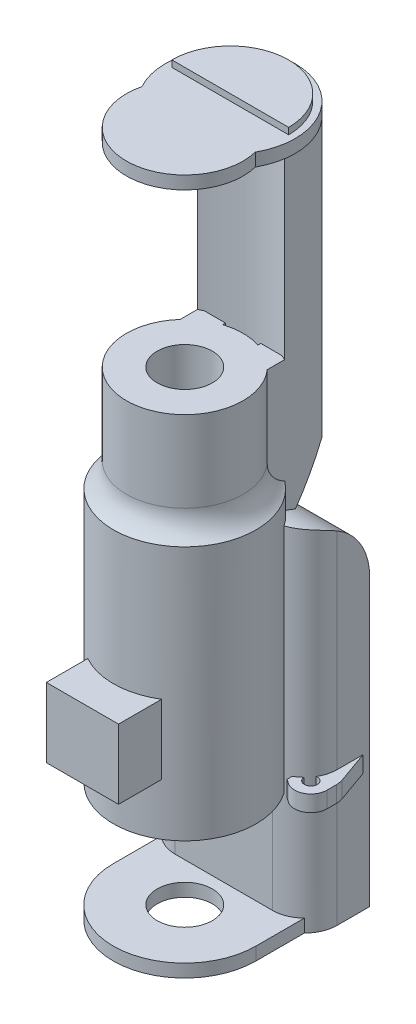
from build123d import *

# Parameters (mm, degrees)
BOSS_EXTRUDE1_DEPTH       = 2
BOSS_EXTRUDE2_DEPTH       = 1
BOSS_EXTRUDE3_DEPTH       = 33
BOSS_EXTRUDE4_DEPTH       = 7
BOSS_EXTRUDE4_DEPTH_BACK  = 7
CUT_EXTRUDE2_DEPTH        = 21
CUT_EXTRUDE3_DEPTH        = 21
CUT_EXTRUDE4_DEPTH        = 21
SKETCH46_R                = 4.25
CUT_EXTRUDE5_DEPTH        = 1
SKETCH47_R                = 9
BOSS_EXTRUDE5_DEPTH       = 17
SKETCH50_R                = 11
BOSS_EXTRUDE6_DEPTH       = 38.5
FILLET7_R                 = 4.5
SKETCH52_W                = 4
SKETCH52_H                = 17
BOSS_EXTRUDE7_DEPTH       = 4.5
BOSS_EXTRUDE8_DEPTH       = 3
BOSS_EXTRUDE8_DEPTH_BACK  = 7
SKETCH54_W                = 25
SKETCH54_H                = 54
FILLET11_R                = 10
FILLET16_R                = 5
BOSS_EXTRUDE9_DEPTH       = 2
CUT_EXTRUDE6_START        = -83
SKETCH56_R                = 4.25
CUT_EXTRUDE6_DEPTH        = 83
BOSS_EXTRUDE10_DEPTH      = 2.5
SKETCH59_W                = 15
SKETCH59_H                = 15
CUT_EXTRUDE7_DEPTH        = 2.5
BOSS_EXTRUDE11_DEPTH      = 5
BOSS_EXTRUDE11_DEPTH_BACK = 5
SKETCH60_W                = 11.132946343
SKETCH60_H                = 10.716090789


with BuildPart() as part:
    # Sketch2 → Boss-Extrude1 (new body)
    with BuildSketch(Plane(origin=(0, 0, 0), x_dir=(1, 0, 0), z_dir=(0, 1, 0))):
        with BuildLine():
            ThreePointArc((-8.74118042, -1.866920913), (0, -13.007777675), (8.74118042, -1.866920913))
            ThreePointArc((8.74118042, -1.866920913), (0, 13.007777675), (-8.74118042, -1.866920913))
        make_face()
    extrude(amount=BOSS_EXTRUDE1_DEPTH)

    # Sketch3 → Boss-Extrude2 (add)
    with BuildSketch(Plane(origin=(0, 2, 0), x_dir=(1, 0, 0), z_dir=(0, 1, 0))):
        with BuildLine():
            Line((-9.005745375, 3.0020323), (9.005745375, 3.0020323))
            ThreePointArc((9.005745375, 3.0020323), (0, 12.007777675), (-9.005745375, 3.0020323))
        make_face()
    extrude(amount=BOSS_EXTRUDE2_DEPTH)

    # Sketch6 → Boss-Extrude3 (add)
    with BuildSketch(Plane.XZ):
        with BuildLine():
            Line((-6.71029845, -10.424082907), (-6.71029845, -4.66194403))
            ThreePointArc((-6.71029845, -4.66194403), (0, -6.229684472), (6.71029845, -4.66194403))
            Line((6.71029845, -4.66194403), (6.71029845, -10.424082907))
            ThreePointArc((6.71029845, -10.424082907), (0, -13.046177942), (-6.71029845, -10.424082907))
        make_face()
    extrude(amount=BOSS_EXTRUDE3_DEPTH)

    # Sketch38 → Boss-Extrude4 (add, two sides: drawn at the far end of the back side and taken through both)
    with BuildSketch(Plane(origin=(0, 0, 0), x_dir=(0, 0, -1), z_dir=(1, 0, 0)).offset(-BOSS_EXTRUDE4_DEPTH_BACK)):
        with BuildLine():
            Line((4.66194403, -33), (4.66194403, -53))
            ThreePointArc((4.66194403, -53), (10.280825791, -43.598116493), (13.046177942, -33))
            Line((13.046177942, -33), (4.66194403, -33))
        make_face()
    extrude(amount=BOSS_EXTRUDE4_DEPTH + BOSS_EXTRUDE4_DEPTH_BACK)

    # Sketch43 → Cut-Extrude2 (cut)
    with BuildSketch(Plane(origin=(0, -33, 0), x_dir=(1, 0, 0), z_dir=(0, 1, 0))):
        with BuildLine():
            Line((-6.71029845, 4.66194403), (6.71029845, 4.66194403))
            ThreePointArc((6.71029845, 4.66194403), (0, 6.229684472), (-6.71029845, 4.66194403))
        make_face()
    extrude(amount=-CUT_EXTRUDE2_DEPTH, mode=Mode.SUBTRACT)

    # Sketch44 → Cut-Extrude3 (cut)
    with BuildSketch(Plane(origin=(0, -33, 0), x_dir=(1, 0, 0), z_dir=(0, 1, 0))):
        with BuildLine():
            Line((0, 13.046177942), (7, 13.046177942))
            Line((7, 13.046177942), (7, 4.66194403))
            Line((7, 4.66194403), (6.71029845, 4.66194403))
            Line((6.71029845, 4.66194403), (6.71029845, 10.424082907))
            ThreePointArc((6.71029845, 10.424082907), (3.602203758, 12.367376636), (0, 13.046177942))
        make_face()
    extrude(amount=-CUT_EXTRUDE3_DEPTH, mode=Mode.SUBTRACT)

    # Sketch45 → Cut-Extrude4 (cut)
    with BuildSketch(Plane(origin=(0, -33, 0), x_dir=(1, 0, 0), z_dir=(0, 1, 0))):
        with BuildLine():
            Line((-6.71029845, 4.66194403), (-7, 4.66194403))
            Line((-7, 4.66194403), (-7, 13.046177942))
            Line((-7, 13.046177942), (0, 13.046177942))
            ThreePointArc((0, 13.046177942), (-3.602203758, 12.367376636), (-6.71029845, 10.424082907))
            Line((-6.71029845, 10.424082907), (-6.71029845, 4.66194403))
        make_face()
    extrude(amount=-CUT_EXTRUDE4_DEPTH, mode=Mode.SUBTRACT)

    # Sketch46 → Cut-Extrude5 (cut)
    with BuildSketch(Plane.XZ):
        with Locations(Location((0, 4.008159027, 0), (0, 0, 270))):
            Circle(SKETCH46_R)
    extrude(amount=-CUT_EXTRUDE5_DEPTH, mode=Mode.SUBTRACT)



with BuildPart() as body_2:
    # Sketch47 → Boss-Extrude5 (new body)
    with BuildSketch(Plane(origin=(0, -30, 0), x_dir=(1, 0, 0), z_dir=(0, 1, 0))):
        with Locations(Location((0, -4.008159027, 0), (0, 0, 270))):
            Circle(SKETCH47_R)
    extrude(amount=-BOSS_EXTRUDE5_DEPTH)


with BuildPart() as part_1:
    add(part.part)

    add(body_2.part)  # Boss-Extrude6 merges body 2
    # Sketch50 → Boss-Extrude6 (add)
    with BuildSketch(Plane(origin=(0, -47, 0), x_dir=(1, 0, 0), z_dir=(0, 1, 0))):
        with Locations(Location((0, -4.008159027, 0), (0, 0, 270))):
            Circle(SKETCH50_R)
    extrude(amount=-BOSS_EXTRUDE6_DEPTH)

    # Fillet7
    # the kernel refuses this fillet: 4.5 mm, written as the material it adds along each edge
    with BuildSketch(Plane(origin=(0, -47, 4.008159027), x_dir=(0, 0, 1), z_dir=(-1, 0, 0))) as fillet7_piece_1_section:
        with BuildLine():
            CenterArc((9 + FILLET7_R, FILLET7_R), FILLET7_R, 180, 90)
            Line((9, FILLET7_R), (9, 0))
            Line((9, 0), (9 + FILLET7_R, 0))
        make_face()
    fillet7_piece_1 = revolve(axis=Axis((0, -47, 4.008159027), (0, 1, 0)), mode=Mode.PRIVATE)
    fillet7_piece_1 = fillet7_piece_1 & Plane(origin=(0, -44.651534587, 4.008159027), x_dir=(0, 0, 1), z_dir=(0, 1, 0)) * Cylinder(11, 54, mode=Mode.PRIVATE)
    add(fillet7_piece_1)

    # Sketch52 → Boss-Extrude7 (add)
    with BuildSketch(Plane.XY.offset(-5)):
        with Locations((-4.71029845, -38.5)):
            Rectangle(SKETCH52_W, SKETCH52_H)
        with Locations((4.71029845, -38.5)):
            Rectangle(SKETCH52_W, SKETCH52_H)
    extrude(amount=BOSS_EXTRUDE7_DEPTH)

    # Sketch54 → Boss-Extrude8 (add, two sides: drawn at the far end of the back side and taken through both)
    with BuildSketch(Plane.XY.offset(-5).offset(-BOSS_EXTRUDE8_DEPTH_BACK)):
        with Locations((0, -76.799982276)):
            Rectangle(SKETCH54_W, SKETCH54_H)
    extrude(amount=BOSS_EXTRUDE8_DEPTH + BOSS_EXTRUDE8_DEPTH_BACK)

    # Fillet11
    # the kernel refuses this fillet: 10 mm, written as the material it takes off along each edge
    with BuildSketch(Plane(origin=(37.5, -49.799982276, -12), x_dir=(0, 0, 1), z_dir=(-1, 0, 0))) as fillet11_piece_1_section:
        with BuildLine():
            CenterArc((FILLET11_R, -FILLET11_R), FILLET11_R, 90, 90)
            Line((0, -FILLET11_R), (0, 0))
            Line((0, 0), (FILLET11_R, 0))
        make_face()
    fillet11_piece_1 = extrude(amount=75, mode=Mode.PRIVATE)
    fillet11_piece_1 = split(fillet11_piece_1, bisect_by=Plane(origin=(6.71029845, -50.105722429, -5.552983342), z_dir=(1, 0, 0)), keep=Keep.TOP, mode=Mode.PRIVATE)
    fillet11_piece_1 = fillet11_piece_1 - Plane(origin=(0, -50.105722429, 4.008159027), x_dir=(0, 0, 1), z_dir=(0, 1, 0)) * Cylinder(11, 190, mode=Mode.PRIVATE)
    add(fillet11_piece_1, mode=Mode.SUBTRACT)
    with BuildSketch(Plane(origin=(37.5, -49.799982276, -12), x_dir=(0, 0, 1), z_dir=(-1, 0, 0))) as fillet11_piece_2_section:
        with BuildLine():
            CenterArc((FILLET11_R, -FILLET11_R), FILLET11_R, 90, 90)
            Line((0, -FILLET11_R), (0, 0))
            Line((0, 0), (FILLET11_R, 0))
        make_face()
    fillet11_piece_2 = extrude(amount=75, mode=Mode.PRIVATE)
    fillet11_piece_2 = fillet11_piece_2 - Plane(origin=(0, -28.608070144, 25.47687493), x_dir=(0, -0.6291022196918398, -0.7773225824448948), z_dir=(-1, 0, 0)) * Cylinder(38.772601801, 190, mode=Mode.PRIVATE)
    add(fillet11_piece_2, mode=Mode.SUBTRACT)
    with BuildSketch(Plane(origin=(37.5, -49.799982276, -12), x_dir=(0, 0, 1), z_dir=(-1, 0, 0))) as fillet11_piece_3_section:
        with BuildLine():
            CenterArc((FILLET11_R, -FILLET11_R), FILLET11_R, 90, 90)
            Line((0, -FILLET11_R), (0, 0))
            Line((0, 0), (FILLET11_R, 0))
        make_face()
    fillet11_piece_3 = extrude(amount=75, mode=Mode.PRIVATE)
    fillet11_piece_3 = split(fillet11_piece_3, bisect_by=Plane(origin=(-6.71029845, -50.105722431, -5.552983374), z_dir=(-1, 0, 0)), keep=Keep.TOP, mode=Mode.PRIVATE)
    fillet11_piece_3 = fillet11_piece_3 - Plane(origin=(0, -50.105722431, 4.008159027), x_dir=(0, 0, 1), z_dir=(0, 1, 0)) * Cylinder(11, 190, mode=Mode.PRIVATE)
    add(fillet11_piece_3, mode=Mode.SUBTRACT)

    # Fillet16
    # the kernel refuses this fillet: 5 mm, written as the material it takes off along each edge
    with BuildSketch(Plane(origin=(12.5, -116.299982276, -2), x_dir=(0, 0, -1), z_dir=(0, 1, 0))) as fillet16_piece_1_section:
        with BuildLine():
            CenterArc((FILLET16_R, FILLET16_R), FILLET16_R, 180, 90)
            Line((0, FILLET16_R), (0, 0))
            Line((0, 0), (FILLET16_R, 0))
        make_face()
    fillet16_piece_1 = extrude(amount=79, mode=Mode.PRIVATE)
    fillet16_piece_1 = split(fillet16_piece_1, bisect_by=Plane(origin=(11.51825919, -85.5, -3.19162615), z_dir=(0, -1, 0)), keep=Keep.TOP, mode=Mode.PRIVATE)
    fillet16_piece_1 = fillet16_piece_1 - Plane(origin=(0, -100.899991138, 4.008159027), x_dir=(0, 0, 1), z_dir=(0, 1, 0)) * Cylinder(11, 178, mode=Mode.PRIVATE)
    add(fillet16_piece_1, mode=Mode.SUBTRACT)
    with BuildSketch(Plane(origin=(12.5, -116.299982276, -2), x_dir=(0, 0, -1), z_dir=(0, 1, 0))) as fillet16_piece_2_section:
        with BuildLine():
            CenterArc((FILLET16_R, FILLET16_R), FILLET16_R, 180, 90)
            Line((0, FILLET16_R), (0, 0))
            Line((0, 0), (FILLET16_R, 0))
        make_face()
    fillet16_piece_2 = extrude(amount=79, mode=Mode.PRIVATE)
    fillet16_piece_2 = split(fillet16_piece_2, bisect_by=Plane(origin=(8.533879218, -85.5, -2.00668073), z_dir=(0, -1, 0)), keep=Keep.TOP, mode=Mode.PRIVATE)
    fillet16_piece_2 = fillet16_piece_2 & Plane(origin=(0, -100.899991138, 4.008159027), x_dir=(0, 0, 1), z_dir=(0, 1, 0)) * Cylinder(11, 178, mode=Mode.PRIVATE)
    add(fillet16_piece_2, mode=Mode.SUBTRACT)
    with BuildSketch(Plane(origin=(12.5, -116.299982276, -2), x_dir=(0, 0, -1), z_dir=(0, 1, 0))) as fillet16_piece_3_section:
        with BuildLine():
            CenterArc((FILLET16_R, FILLET16_R), FILLET16_R, 180, 90)
            Line((0, FILLET16_R), (0, 0))
            Line((0, 0), (FILLET16_R, 0))
        make_face()
    fillet16_piece_3 = extrude(amount=79, mode=Mode.PRIVATE)
    fillet16_piece_3 = split(fillet16_piece_3, bisect_by=Plane(origin=(11.51825919, -85.5, -3.19162615), z_dir=(0, 1, 0)), keep=Keep.TOP, mode=Mode.PRIVATE)
    fillet16_piece_3 = fillet16_piece_3 - Plane(origin=(0, -61.399991138, 4.008159027), x_dir=(0, 0, 1), z_dir=(0, 1, 0)) * Cylinder(11, 178, mode=Mode.PRIVATE)
    add(fillet16_piece_3, mode=Mode.SUBTRACT)
    with BuildSketch(Plane(origin=(-12.5, -37.299982276, -2), x_dir=(0, 0, -1), z_dir=(0, -1, 0))) as fillet16_piece_4_section:
        with BuildLine():
            CenterArc((FILLET16_R, FILLET16_R), FILLET16_R, 180, 90)
            Line((0, FILLET16_R), (0, 0))
            Line((0, 0), (FILLET16_R, 0))
        make_face()
    fillet16_piece_4 = extrude(amount=79, mode=Mode.PRIVATE)
    fillet16_piece_4 = fillet16_piece_4 - Plane(origin=(0, -61.399991138, 4.008159027), x_dir=(0, 0, 1), z_dir=(0, 1, 0)) * Cylinder(11, 178, mode=Mode.PRIVATE)
    fillet16_piece_4 = split(fillet16_piece_4, bisect_by=Plane(origin=(-11.51825919, -85.5, -3.19162615), z_dir=(0, 1, 0)), keep=Keep.TOP, mode=Mode.PRIVATE)
    add(fillet16_piece_4, mode=Mode.SUBTRACT)
    with BuildSketch(Plane(origin=(-12.5, -37.299982276, -2), x_dir=(0, 0, -1), z_dir=(0, -1, 0))) as fillet16_piece_5_section:
        with BuildLine():
            CenterArc((FILLET16_R, FILLET16_R), FILLET16_R, 180, 90)
            Line((0, FILLET16_R), (0, 0))
            Line((0, 0), (FILLET16_R, 0))
        make_face()
    fillet16_piece_5 = extrude(amount=79, mode=Mode.PRIVATE)
    fillet16_piece_5 = fillet16_piece_5 - Plane(origin=(0, -100.899991138, 4.008159027), x_dir=(0, 0, 1), z_dir=(0, 1, 0)) * Cylinder(11, 178, mode=Mode.PRIVATE)
    fillet16_piece_5 = split(fillet16_piece_5, bisect_by=Plane(origin=(-11.51825919, -85.5, -3.19162615), z_dir=(0, -1, 0)), keep=Keep.TOP, mode=Mode.PRIVATE)
    add(fillet16_piece_5, mode=Mode.SUBTRACT)
    with BuildSketch(Plane(origin=(-12.5, -37.299982276, -2), x_dir=(0, 0, -1), z_dir=(0, -1, 0))) as fillet16_piece_6_section:
        with BuildLine():
            CenterArc((FILLET16_R, FILLET16_R), FILLET16_R, 180, 90)
            Line((0, FILLET16_R), (0, 0))
            Line((0, 0), (FILLET16_R, 0))
        make_face()
    fillet16_piece_6 = extrude(amount=79, mode=Mode.PRIVATE)
    fillet16_piece_6 = fillet16_piece_6 & Plane(origin=(0, -100.899991138, 4.008159027), x_dir=(0, 0, 1), z_dir=(0, 1, 0)) * Cylinder(11, 178, mode=Mode.PRIVATE)
    fillet16_piece_6 = split(fillet16_piece_6, bisect_by=Plane(origin=(-8.533879218, -85.5, -2.00668073), z_dir=(0, -1, 0)), keep=Keep.TOP, mode=Mode.PRIVATE)
    add(fillet16_piece_6, mode=Mode.SUBTRACT)

    # Sketch55 → Boss-Extrude9 (add)
    with BuildSketch(Plane.XZ.offset(103.799982276)):
        with BuildLine():
            Line((-11, -5), (11, -5))
            Line((11, -5), (11, 4.008159027))
            ThreePointArc((11, 4.008159027), (0, 15.033520303), (-11, 4.008159027))
            Line((-11, 4.008159027), (-11, -5))
        make_face()
    extrude(amount=-BOSS_EXTRUDE9_DEPTH)

    # Sketch56 → Cut-Extrude6 (cut)
    with BuildSketch(Plane(origin=(0, -30, 0), x_dir=(1, 0, 0), z_dir=(0, 1, 0)).offset(CUT_EXTRUDE6_START)):
        with Locations(Location((0, -4.008159027, 0), (0, 0, 90))):
            Circle(SKETCH56_R)
    extrude(amount=CUT_EXTRUDE6_DEPTH, mode=Mode.SUBTRACT)

    # Sketch58 → Boss-Extrude10 (add)
    with BuildSketch(Plane(origin=(0, -85.5, 0), x_dir=(1, 0, 0), z_dir=(0, 1, 0))):
        with BuildLine():
            Line((-12.503756293, 10.7055016), (-12.503756293, 10.967623814))
            Line((-12.503756293, 10.967623814), (-14.284395942, 5.954796895))
            ThreePointArc((-14.284395942, 5.954796895), (-14.399896686, 5.457707003), (-14.457430322, 4.950628446))
            Line((-14.457430322, 4.950628446), (-14.457430322, 3.467540502))
            ThreePointArc((-14.457430322, 3.467540502), (-13.045141258, 1.216634056), (-10.403991329, 1.508981939))
            ThreePointArc((-10.403991329, 1.508981939), (-10.176629296, 1.672677814), (-9.935026042, 1.814514698))
            Line((-9.935026042, 1.814514698), (-9.935026042, 2.633004674))
            Line((-9.935026042, 2.633004674), (-10.95990675, 3.398756648))
            ThreePointArc((-10.95990675, 3.398756648), (-12.741140623, 2.846277711), (-11.796984516, 4.454567589))
            Line((-11.796984516, 4.454567589), (-11.885717448, 4.626710904))
            Line((-11.885717448, 4.626710904), (-12.141623772, 5.12317329))
            Line((-12.141623772, 5.12317329), (-12.22909809, 5.3725854))
            Line((-12.22909809, 5.3725854), (-12.297457465, 5.567027196))
            Line((-12.297457465, 5.567027196), (-12.408358344, 6.092489346))
            Line((-12.408358344, 6.092489346), (-12.439303168, 6.239029034))
            Line((-12.439303168, 6.239029034), (-12.503756293, 6.967623814))
            Line((-12.503756293, 6.967623814), (-12.503756293, 8.899304494))
            Line((-12.503756293, 8.899304494), (-12.503756293, 9.616252049))
            Line((-12.503756293, 9.616252049), (-12.503756293, 10.7055016))
        make_face()
        with BuildLine():
            Line((14.284395942, 5.954796895), (12.503756293, 10.967623814))
            Line((12.503756293, 10.967623814), (12.503756293, 10.7055016))
            Line((12.503756293, 10.7055016), (12.503756293, 9.616252049))
            Line((12.503756293, 9.616252049), (12.503756293, 8.899304494))
            Line((12.503756293, 8.899304494), (12.503756293, 6.967623814))
            Line((12.503756293, 6.967623814), (12.439303168, 6.239029034))
            Line((12.439303168, 6.239029034), (12.408358344, 6.092489346))
            Line((12.408358344, 6.092489346), (12.297457465, 5.567027196))
            Line((12.297457465, 5.567027196), (12.22909809, 5.3725854))
            Line((12.22909809, 5.3725854), (12.141623772, 5.12317329))
            Line((12.141623772, 5.12317329), (11.885717448, 4.626710904))
            Line((11.885717448, 4.626710904), (11.796984516, 4.454567589))
            ThreePointArc((11.796984516, 4.454567589), (12.60539873, 4.229299591), (12.957538336, 3.467540502))
            ThreePointArc((12.957538336, 3.467540502), (11.991950644, 2.468132781), (10.95990675, 3.398756648))
            Line((10.95990675, 3.398756648), (9.935026042, 2.633004674))
            Line((9.935026042, 2.633004674), (9.935026042, 1.814514698))
            ThreePointArc((9.935026042, 1.814514698), (10.176629296, 1.672677814), (10.403991329, 1.508981939))
            ThreePointArc((10.403991329, 1.508981939), (13.045141258, 1.216634056), (14.457430322, 3.467540502))
            Line((14.457430322, 3.467540502), (14.457430322, 4.950628446))
            ThreePointArc((14.457430322, 4.950628446), (14.399896686, 5.457707003), (14.284395942, 5.954796895))
        make_face()
    extrude(amount=BOSS_EXTRUDE10_DEPTH)

    # Sketch59 → Cut-Extrude7 (cut)
    with BuildSketch(Plane(origin=(0, 0, -12), x_dir=(-1, 0, 0), z_dir=(0, 0, -1))):
        with Locations((0, -72.428324933)):
            Rectangle(SKETCH59_W, SKETCH59_H)
    extrude(amount=-CUT_EXTRUDE7_DEPTH, mode=Mode.SUBTRACT)

    # Sketch60 → Boss-Extrude11 (add, two sides: drawn at the far end of the back side and taken through both)
    with BuildSketch(Plane.XY.offset(15).offset(-BOSS_EXTRUDE11_DEPTH_BACK)):
        with Locations((0.213791453, -72.150091038)):
            Rectangle(SKETCH60_W, SKETCH60_H)
    extrude(amount=BOSS_EXTRUDE11_DEPTH + BOSS_EXTRUDE11_DEPTH_BACK)


solid = part_1.part
